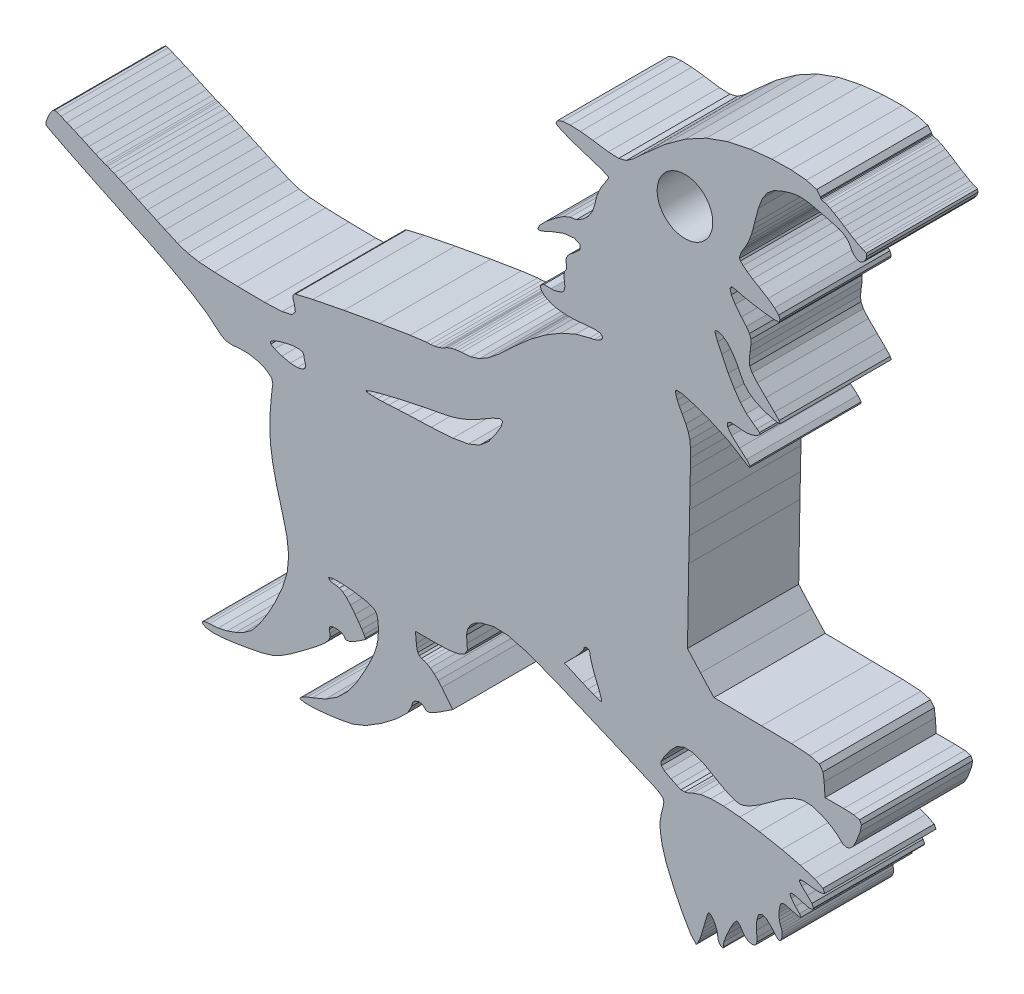
from build123d import *

# Parameters (mm, degrees)
BOSS_EXTRU_4_DEPTH      = 5
ESQUISSE8_R             = 1.25
ENL_V_MAT_EXTRU_1_DEPTH = 5


with BuildPart() as part:
    # Esquisse7 → Boss.-Extru.4 (new body)
    with BuildSketch(Plane.XY):
        Polygon((32.533763082, 34.408827277), (31.50376639, 34.193223455), (30.550335001, 33.849328679), (29.629146309, 33.352969468), (28.695870877, 32.67996209), (27.706172431, 31.806126231), (27.285148669, 31.41185523), (26.957491395, 31.184164666), (26.615053656, 31.094832785), (26.149702163, 31.115654912), (25.453296794, 31.218419543), (24.898611712, 31.285696025), (24.437964414, 31.303272702), (24.088139005, 31.271815745), (23.865929836, 31.192001575), (23.788127845, 31.064496363), (23.848689661, 31.005388167), (24.01738989, 30.91740571), (24.274748996, 30.808594293), (24.60129086, 30.68702313), (24.977534237, 30.560747773), (25.353777615, 30.444437657), (25.680321187, 30.335516919), (25.937678585, 30.241371522), (26.106378814, 30.169390845), (26.16694063, 30.126964265), (26.15272214, 30.09125406), (26.113655456, 30.022634986), (26.055107527, 29.928486173), (25.982457262, 29.816207248), (25.901073319, 29.693180757), (25.809614813, 29.546308746), (25.723531799, 29.367870457), (25.648191226, 29.173310819), (25.58897371, 28.978081594), (25.551247909, 28.797627709), (25.444115586, 28.463807495), (25.255044176, 28.165589874), (25.006191566, 27.925136149), (24.719727601, 27.764607623), (24.417813582, 27.706172431), (24.141646236, 27.595907394), (23.743238139, 27.32780243), (23.338783256, 26.995886783), (23.044482381, 26.694198238), (22.976532895, 26.516766039), (23.021644658, 26.507697567), (23.115791763, 26.528183193), (23.247550224, 26.574193433), (23.405502887, 26.641697097), (23.5782326, 26.726661285), (24.155528224, 26.942712638), (24.613268281, 26.987491315), (24.878911827, 26.887861107), (24.879919625, 26.670689219), (24.54375073, 26.362842859), (24.417811874, 26.267467607), (24.325460016, 26.16738816), (24.266688322, 26.064625238), (24.241501918, 25.961187604), (24.249897386, 25.859094269), (24.268480152, 25.775920204), (24.274303174, 25.697446917), (24.268030914, 25.628378604), (24.250346624, 25.573412628), (24.221911353, 25.537254893), (24.192020753, 25.499865594), (24.17086554, 25.426205823), (24.160454476, 25.323666666), (24.162804865, 25.199632377), (24.179932304, 25.061492336), (24.194261822, 24.899060951), (24.18373973, 24.776259933), (24.143661831, 24.685696489), (24.069332473, 24.619984656), (23.956044042, 24.571736762), (23.861562143, 24.541624106), (23.767754956, 24.518899119), (23.682005028, 24.504234807), (23.611705152, 24.498302465), (23.564239583, 24.501771681), (23.256840753, 24.505242605), (23.106612262, 24.40863579), (23.112881106, 24.252919071), (23.27497599, 24.079070532), (23.592225616, 23.928058009), (23.806261373, 23.871078146), (24.058584907, 23.83492041), (24.343817309, 23.820256098), (24.65659163, 23.827756505), (24.991527254, 23.858092927), (25.36407765, 23.889437147), (25.621101962, 23.897274056), (25.781406723, 23.878242051), (25.863796756, 23.828988068), (25.887080302, 23.746148796), (25.862341428, 23.672600053), (25.78991322, 23.60442851), (25.672482569, 23.543641221), (25.512739784, 23.492260614), (25.313366631, 23.452295452), (24.685471016, 23.285385345), (24.017950157, 22.99018941), (23.321544789, 22.572751016), (22.607005893, 22.039113534), (21.885077618, 21.395322044), (21.261882782, 20.810637042), (20.768323199, 20.41200518), (20.352674927, 20.167183762), (19.963220858, 20.043933506), (19.548243882, 20.010013423), (19.389168976, 20.000386391), (19.222709816, 19.973297128), (19.061622731, 19.931429107), (18.918670882, 19.877472637), (18.806614014, 19.814111193), (18.689741923, 19.74940545), (18.533246296, 19.692763796), (18.351224346, 19.648881888), (18.157786951, 19.622462212), (17.967033031, 19.618208964), (17.237493321, 19.524958628), (15.865171626, 19.295363498), (14.268510722, 19.004644576), (12.865963634, 18.728029699), (12.075973136, 18.540746703), (12.013843255, 18.506604563), (11.978581434, 18.452311591), (11.970185966, 18.3745096), (11.98865685, 18.269842111), (12.033994086, 18.134949228), (12.080786651, 17.848147052), (11.92137866, 17.664112923), (11.483900463, 17.56470648), (10.696485827, 17.531794195), (9.487265105, 17.54724254), (8.44293804, 17.580042088), (7.74519008, 17.628289981), (7.243568969, 17.717509126), (6.787620315, 17.873224136), (6.226892289, 18.120956211), (5.835871009, 18.299731002), (5.422685436, 18.489924655), (5.01890313, 18.676087116), (4.656092502, 18.84277175), (4.36582111, 18.974530211), (4.131074254, 19.079310437), (3.921850731, 19.171327501), (3.750240272, 19.244539742), (3.628333035, 19.292900372), (3.568219177, 19.310362604), (3.497582586, 19.335772774), (3.332241184, 19.406187094), (3.091673014, 19.512870179), (2.795356971, 19.647090058), (2.462770883, 19.800118177), (2.118654477, 19.953144588), (1.805434974, 20.087367883), (1.543933435, 20.194050968), (1.354971772, 20.26446358), (1.259371474, 20.28987375), (1.156942492, 20.217780336), (1.037722039, 20.042254412), (0.93193487, 19.824409521), (0.869805896, 19.625374577), (0.881560032, 19.506264833), (1.127277365, 19.371482979), (1.705468905, 19.079534202), (2.478443206, 18.698251836), (3.308508827, 18.295477754), (4.05797475, 17.939046999), (5.515487387, 17.248464652), (6.637167632, 16.682809946), (7.483464989, 16.209174014), (8.114830674, 15.794644569), (8.591712057, 15.406311034), (8.74966472, 15.272760743), (8.901573159, 15.187572789), (9.068258646, 15.145369975), (9.270541602, 15.140780225), (9.529244154, 15.168429755), (9.972765722, 15.174138332), (10.407558736, 15.08984544), (10.77451073, 14.939727978), (11.014519486, 14.747967968), (11.068475956, 14.538744018), (11.048660772, 14.422768696), (11.024145664, 14.222166542), (10.996943663, 13.956411113), (10.969069513, 13.6449828), (10.942538809, 13.307358577), (10.930784299, 12.690658058), (10.969406015, 12.081346918), (11.068475956, 11.426361186), (11.238071246, 10.672642014), (11.488266448, 9.767125433), (11.700512083, 8.920715339), (11.779098106, 8.207967419), (11.717976023, 7.547608757), (11.511103317, 6.858369429), (11.152434054, 6.058976092), (10.92888144, 5.640304854), (10.690553485, 5.241784021), (10.456254159, 4.890279518), (10.244791703, 4.612658124), (10.074971793, 4.435786192), (9.76589387, 4.216935638), (9.405769279, 4.035026425), (9.014076703, 3.896774928), (8.610294824, 3.808899229), (8.213900615, 3.778114422), (8.090538476, 3.771621386), (7.99269839, 3.753039046), (7.925756702, 3.723709568), (7.895083777, 3.684976823), (7.906054254, 3.638184259), (8.052365145, 3.547509572), (8.341069325, 3.510568018), (8.773509387, 3.527359595), (9.351029631, 3.597884303), (10.074971793, 3.722142357), (10.616669095, 3.833414765), (11.040154276, 3.960807241), (11.432070617, 4.147306204), (11.879063962, 4.435898075), (12.467777594, 4.8695697), (13.003653582, 5.278501597), (13.356166737, 5.571906983), (13.556882482, 5.785384609), (13.637370511, 5.954532368), (13.629197954, 6.114948158), (13.601771334, 6.250512337), (13.60792915, 6.343090522), (13.654386066, 6.400069959), (13.747859313, 6.428839597), (13.895065265, 6.436787535), (14.009807316, 6.428727714), (14.114476513, 6.405890845), (14.202351358, 6.370292523), (14.266719746, 6.323947915), (14.30086274, 6.268871338), (14.363440151, 6.217041065), (14.485795346, 6.230363213), (14.670613508, 6.310179091), (14.920586652, 6.457833), (15.238394837, 6.674668813), (15.227871037, 6.719557665), (15.167645723, 6.828928495), (15.065104858, 6.99001558), (14.92763782, 7.19006003), (14.76263228, 7.416298681), (14.558334583, 7.68250164), (14.377544196, 7.8801957), (14.213546454, 8.014752081), (14.059623274, 8.09154542), (13.909058281, 8.1159495), (13.804278055, 8.122442109), (13.712261845, 8.141024876), (13.639049604, 8.170354355), (13.590689829, 8.209087099), (13.573225888, 8.255879664), (13.744946948, 8.316329597), (14.16787357, 8.319687784), (14.70363853, 8.276029642), (15.213879729, 8.195429731), (15.560234214, 8.087963467), (15.661656253, 8.021020071), (15.733524194, 7.915121873), (15.779869228, 7.76153434), (15.804720838, 7.551527212), (15.812108509, 7.276368517), (15.795204836, 6.973000025), (15.737329911, 6.666272918), (15.62773617, 6.329321271), (15.455679462, 5.935277879), (15.210408805, 5.457276388), (14.815246159, 4.763558765), (14.403292576, 4.212905728), (13.95103733, 3.783823426), (13.434974818, 3.454819717), (12.83159602, 3.204400751), (12.623155249, 3.1265994), (12.457030882, 3.048798477), (12.341952329, 2.977713928), (12.286652414, 2.920062769), (12.299861398, 2.882561374), (12.522964773, 2.841254048), (12.942868855, 2.847634775), (13.487701433, 2.895658902), (14.085594565, 2.979281139), (14.664681166, 3.09245662), (15.244663681, 3.32888257), (15.946217359, 3.761434942), (16.622248131, 4.277273262), (17.125661926, 4.763558765), (17.309361261, 5.107450979), (17.345071467, 5.273015932), (17.460710287, 5.390893686), (17.61866295, 5.446977634), (17.781318101, 5.427163304), (17.911060966, 5.317346224), (17.968824862, 5.265292186), (18.060841926, 5.260254905), (18.191145059, 5.302233527), (18.363763742, 5.391229334), (18.582725752, 5.52724147), (19.156439424, 5.905052912), (18.66668385, 6.520745633), (18.497758148, 6.708587615), (18.319434304, 6.878295215), (18.145807822, 7.018449144), (17.990989581, 7.117631822), (17.869081917, 7.164424386), (17.74403983, 7.19397763), (17.651240441, 7.253084972), (17.585976139, 7.347788928), (17.543547851, 7.484137139), (17.519256507, 7.668172976), (17.477277458, 8.1159495), (18.400816539, 8.1159495), (19.013822368, 8.137665835), (19.439434173, 8.209087099), (19.698472373, 8.339613997), (19.811760804, 8.538650648), (19.800118177, 8.815600319), (19.773027205, 9.115945418), (19.825193553, 9.378007866), (19.95527292, 9.600440799), (20.161921007, 9.781902482), (20.443796931, 9.921048613), (21.002509788, 10.05694844), (21.625702916, 10.03433619), (22.471889244, 9.812238904), (23.699579997, 9.349686185), (25.467289811, 8.605705073), (25.896034329, 8.423571241), (26.368442115, 8.223304735), (26.847561151, 8.020348775), (27.29645821, 7.830155976), (27.678186399, 7.668172976), (28.159881298, 7.462978509), (28.455526472, 7.312861901), (28.604077577, 7.185582162), (28.644488561, 7.048898303), (28.615718496, 6.870571042), (28.528065709, 6.518282934), (28.482057176, 6.24525129), (28.475675596, 5.993040921), (28.506908787, 5.703217487), (28.573739447, 5.317346224), (28.753855121, 4.728519429), (29.094504446, 3.931477762), (29.497613322, 3.121002279), (29.865128145, 2.491876382), (30.098978232, 2.238882621), (30.133345846, 2.26921947), (30.182492216, 2.353961387), (30.241036729, 2.483704466), (30.303612432, 2.649046081), (30.364845544, 2.840582325), (30.423167999, 3.036372458), (30.47880527, 3.228132895), (30.529068759, 3.401758309), (30.571273282, 3.543143801), (30.602726822, 3.638184259), (30.635748428, 3.718336212), (30.672135053, 3.755501746), (30.718589408, 3.746993968), (30.781838115, 3.690126414), (30.868594133, 3.582212193), (30.931955577, 3.481350422), (30.985912047, 3.369742366), (31.02777836, 3.25679065), (31.054869331, 3.151898969), (31.064496363, 3.064470587), (31.072333272, 2.979840552), (31.09360293, 2.897897623), (31.12494715, 2.824686236), (31.163007744, 2.766251472), (31.204426526, 2.728638194), (31.249651026, 2.703338839), (31.284131376, 2.694159552), (31.307191157, 2.700428396), (31.31816078, 2.721473862), (31.316370657, 2.756624227), (31.345364488, 2.956444484), (31.467717975, 3.287239382), (31.635746908, 3.648259248), (31.801760246, 3.938754404), (31.918070362, 4.05797475), (31.964524716, 4.043646086), (32.017702278, 4.003793661), (32.074231195, 3.943119962), (32.130763527, 3.866326623), (32.183937673, 3.778114422), (32.245058048, 3.689902222), (32.32364578, 3.613108883), (32.413647248, 3.552434971), (32.5090225, 3.512582973), (32.603728164, 3.498254095), (32.715559559, 3.512806738), (32.786423118, 3.56765955), (32.82235538, 3.679603895), (32.829409965, 3.865430708), (32.81362341, 4.141932848), (32.82201717, 4.550864318), (32.90765607, 4.800611989), (33.060462132, 4.886473373), (33.270353961, 4.803746411), (33.527267245, 4.547730323), (33.66484702, 4.382389136), (33.764810314, 4.28622857), (33.836568934, 4.254548702), (33.889517606, 4.282646618), (33.93306472, 4.36582111), (33.958362154, 4.450115284), (33.967545071, 4.54649876), (33.961276227, 4.646913001), (33.940232042, 4.743296905), (33.905078688, 4.827590651), (33.866905356, 4.919944217), (33.838136999, 5.03916499), (33.821455383, 5.175177554), (33.819552524, 5.317906064), (33.835113606, 5.457276388), (33.868586158, 5.635379456), (33.914818456, 5.740271138), (33.993290034, 5.782697717), (34.123483846, 5.773406761), (34.324869179, 5.723143699), (34.616928984, 5.644334765), (34.777349898, 5.616572924), (34.815519813, 5.650604036), (34.740853953, 5.757174811), (34.562750457, 5.947031961), (34.378156061, 6.167337844), (34.311771224, 6.309058984), (34.364275782, 6.37421055), (34.53633249, 6.364807711), (34.828617769, 6.282864354), (35.131650613, 6.201144763), (35.315127891, 6.203383697), (35.37367582, 6.282864354), (35.301917199, 6.432869507), (35.09448508, 6.64668278), (34.849887427, 6.873033314), (34.739624098, 7.020128664), (34.767049863, 7.096026515), (34.935526327, 7.108788396), (35.24840826, 7.066473272), (35.428076404, 7.048001961), (35.590957028, 7.042965107), (35.726968737, 7.051361002), (35.826040386, 7.073190073), (35.878093997, 7.108452321), (35.798163674, 7.269091876), (35.420020854, 7.456598637), (34.787981311, 7.657538147), (33.946388149, 7.858478511), (32.939560557, 8.045984418), (32.058560793, 8.173599805), (31.335402663, 8.23740878), (30.753291815, 8.23740878), (30.295440729, 8.173600659), (29.945055052, 8.045984418), (29.742436448, 7.952511171), (29.580119508, 7.909412442), (29.421157339, 7.920047271), (29.228613297, 7.987773846), (28.965543906, 8.1159495), (28.676391341, 8.273678398), (28.529633774, 8.410586023), (28.523253901, 8.576375595), (28.655234419, 8.820750337), (28.923564857, 9.193411761), (29.213612483, 9.494093363), (29.541273173, 9.64096452), (29.924010867, 9.634695676), (30.379286091, 9.47595898), (30.924566199, 9.165425729), (31.183491662, 9.012398464), (31.444436137, 8.878176877), (31.689255847, 8.771493792), (31.899824097, 8.701082033), (32.058000526, 8.675670155), (32.222780592, 8.706789756), (32.442641079, 8.797017552), (32.7088466, 8.941649349), (33.012661769, 9.135984367), (33.345358032, 9.375320974), (33.973028174, 9.831045436), (34.477787978, 10.116167664), (34.907984408, 10.244790849), (35.311991761, 10.231022452), (35.738163833, 10.08896481), (35.931046085, 9.997841098), (36.115865955, 9.897316683), (36.281206289, 9.794775818), (36.415649933, 9.697607882), (36.507779734, 9.613202253), (36.681961359, 9.448420478), (36.850106445, 9.389762375), (37.009516145, 9.43588279), (37.157505275, 9.585439985), (37.291388651, 9.837090515), (37.47228665, 10.305912932), (37.529604724, 10.598758478), (37.440498316, 10.757942704), (37.18213312, 10.825781162), (36.731667996, 10.844587694), (35.892087014, 10.844587694), (35.850107964, 11.432294382), (35.800739537, 11.801262826), (35.629803363, 12.026494533), (35.202285283, 12.14560257), (34.383191634, 12.196201706), (33.037511672, 12.215903299), (30.896580166, 12.243889332), (30.294880462, 12.901561102), (29.707173774, 13.559232872), (29.763145839, 16.88957077), (29.78665315, 17.982817878), (29.80680569, 19.016283786), (29.823596627, 19.920122982), (29.837029376, 20.62447458), (29.847103938, 21.059489651), (29.844080544, 21.427561325), (29.812849061, 21.73048485), (29.745347105, 22.000492673), (29.633515711, 22.269830908), (29.469292495, 22.57073542), (29.342125493, 22.797421602), (29.247867359, 23.000602182), (29.189206694, 23.170197472), (29.168835513, 23.296134619), (29.189432168, 23.368337354), (29.490111207, 23.358373821), (30.083642624, 23.184525282), (30.809489354, 22.907910405), (31.507124577, 22.589654689), (32.016021476, 22.290875093), (32.341331777, 22.07112905), (32.509473447, 22.00385086), (32.51775447, 22.070233989), (32.363496496, 22.251471906), (32.044007509, 22.528756371), (31.696867283, 22.84264781), (31.513618895, 23.088700792), (31.496937279, 23.256169458), (31.649517867, 23.334306242), (31.974042427, 23.312365288), (32.146884876, 23.288745241), (32.322412508, 23.284603021), (32.489881174, 23.299267333), (32.638543308, 23.33206859), (32.757651344, 23.38233037), (32.903064612, 23.459683122), (32.967211796, 23.520916234), (32.946054875, 23.586853541), (32.835566072, 23.678310338), (32.631714197, 23.816113878), (32.358679564, 24.029365603), (32.089682956, 24.323222363), (31.818663919, 24.707748472), (31.539589332, 25.193027031), (31.246405576, 25.789129187), (31.063936095, 26.178357783), (30.965424713, 26.414450648), (30.944155055, 26.535685308), (30.993414162, 26.580351249), (31.106475412, 26.586731121), (31.287598884, 26.525159799), (31.497610283, 26.356128193), (31.715004227, 26.103131655), (31.918295835, 25.789689455), (32.085986558, 25.439303778), (32.248194178, 25.146343787), (32.470179581, 24.902420846), (32.757989555, 24.702823928), (33.117664053, 24.542855669), (33.555253278, 24.417813582), (33.779698391, 24.376169327), (33.8731742, 24.39027508), (33.822241124, 24.492368415), (33.613466413, 24.71469032), (33.233413901, 25.089478369), (32.844854893, 25.471543059), (32.613467932, 25.738085082), (32.504994725, 25.95491876), (32.485180395, 26.187875494), (32.519770066, 26.502773023), (32.560963375, 26.802333235), (32.557161073, 27.025329853), (32.493577572, 27.216080356), (32.35543753, 27.418924434), (32.127965607, 27.678186399), (31.850568406, 28.022861791), (31.678621018, 28.316493077), (31.620185827, 28.531536633), (31.683321797, 28.640459078), (31.876091313, 28.615718496), (32.211363438, 28.524707521), (32.697760824, 28.431682659), (33.211027125, 28.354777437), (33.626899162, 28.312127092), (33.821120589, 28.321865152), (33.871606135, 28.439405123), (33.80522813, 28.590530383), (33.622642497, 28.775237516), (33.324535905, 28.993529938), (32.911574525, 29.245404233), (32.638656045, 29.407946647), (32.40066203, 29.568473465), (32.212371236, 29.714897946), (32.088562421, 29.835126517), (32.044007509, 29.917069019), (32.056767254, 29.999459053), (32.092368139, 30.106032817), (32.146772139, 30.227378506), (32.215954897, 30.354097978), (32.295881804, 30.476789675), (32.385213685, 30.634966103), (32.479919349, 30.845534353), (32.571936414, 31.090354063), (32.653209329, 31.351298538), (32.715672295, 31.610224001), (32.889966656, 32.283675494), (33.079043191, 32.769741502), (33.311103156, 33.109379613), (33.614361474, 33.34356791), (34.017022819, 33.513274229), (34.330687076, 33.609209748), (34.591969761, 33.66283484), (34.839139861, 33.675481849), (35.110493692, 33.648503614), (35.444310489, 33.583239311), (36.093919877, 33.424055085), (36.520542896, 33.297113556), (36.783274077, 33.174196385), (36.941228448, 33.027102316), (37.053507373, 32.827616426), (37.126717905, 32.704029668), (37.209336828, 32.604623225), (37.297322702, 32.533428289), (37.386654583, 32.494472633), (37.473297864, 32.491784033), (37.617033746, 32.56857481), (37.719798376, 32.703134607), (37.767486002, 32.852469745), (37.745994287, 32.973589961), (37.641214061, 33.023518656), (37.556251581, 33.048928826), (37.411504485, 33.119344854), (37.221088776, 33.226024523), (36.999103373, 33.36024611), (36.759654029, 33.513274229), (36.525465732, 33.666298932), (36.303371008, 33.800523935), (36.10881137, 33.90720702), (35.95723858, 33.977619632), (35.864100981, 34.003029802), (35.807565232, 34.009411383), (35.757756106, 34.027210117), (35.71801471, 34.054410409), (35.691706062, 34.089003496), (35.682191768, 34.12896695), (35.514610365, 34.331363496), (35.053513829, 34.465246873), (34.361361709, 34.525923134), (33.500627221, 34.508684667), align=None)
        Polygon((21.1014687, 17.617207622), (20.758470694, 17.138758173), (20.369129362, 16.808747094), (19.860232462, 16.597620285), (19.158566048, 16.475825357), (18.190921293, 16.413808213), (17.688404267, 16.395561948), (17.179842162, 16.375300088), (16.702848042, 16.354366932), (16.295036679, 16.334105071), (15.994017722, 16.315857099), (15.761060988, 16.310930846), (15.557660059, 16.313393972), (15.396572974, 16.323917773), (15.290561185, 16.343171835), (15.252387854, 16.371829164), (15.475603112, 16.465861824), (16.064206569, 16.627061646), (16.896623647, 16.825203236), (17.851283182, 17.030061201), (18.806614014, 17.211410147), (19.116363233, 17.28092599), (19.447605876, 17.384700126), (19.784893598, 17.516682352), (20.112778053, 17.670829298), (20.415810898, 17.841095884), (20.951909797, 18.150956132), (21.275764769, 18.28820282), (21.40013556, 18.248124922), (21.337783622, 18.026026782), align=None, mode=Mode.SUBTRACT)
        Polygon((12.453784578, 16.38582218), (12.458486211, 16.334774659), (12.471247664, 16.269624801), (12.490054196, 16.19641256), (12.512891065, 16.121186432), (12.537742676, 16.049989787), (12.5346074, 15.889685026), (12.405201037, 15.781772087), (12.171013593, 15.731621335), (11.853540202, 15.744606553), (11.474273431, 15.826101525), (11.148403717, 15.941740346), (10.976346155, 16.042600409), (10.95742774, 16.137417101), (11.090977177, 16.234922394), (11.376322317, 16.343843131), (11.708683786, 16.43283851), (12.003433899, 16.481533934), (12.239747112, 16.489929402), (12.396804714, 16.458026623), align=None, mode=Mode.SUBTRACT)
        Polygon((25.327359647, 11.138441038), (25.341687457, 11.040154276), (25.38154159, 10.8894774), (25.442214435, 10.70118746), (25.519008628, 10.490060652), (25.607219975, 10.270874023), (25.693752228, 10.059635331), (25.765510848, 9.870561359), (25.817786516, 9.715743118), (25.845885286, 9.607269911), (25.845101253, 9.557230187), (25.78722462, 9.559693313), (25.657483463, 9.597082612), (25.471319294, 9.664025155), (25.244185581, 9.755147158), (24.991527254, 9.865076548), (24.179932304, 10.228894973), (24.613715812, 10.662678481), (24.750173343, 10.810893085), (24.869173767, 10.948360122), (24.963317456, 11.067691924), (25.025223571, 11.161501673), (25.047499319, 11.222399136), (25.05533452, 11.255534333), (25.076605887, 11.285984346), (25.107950107, 11.311058868), (25.146010701, 11.328074423), (25.187429483, 11.334343267), (25.23422034, 11.324715382), (25.272955647, 11.297626119), (25.302284271, 11.255758952), (25.320867038, 11.201801628), align=None, mode=Mode.SUBTRACT)
    extrude(amount=BOSS_EXTRU_4_DEPTH)

    # Esquisse8 → Enlèv. mat.-Extru.1 (cut)
    with BuildSketch(Plane(origin=(0, 0, 0), x_dir=(-1, 0, 0), z_dir=(0, 0, -1))):
        with Locations((-29.59355309, 30.711050741)):
            Circle(ESQUISSE8_R)
    extrude(amount=-ENL_V_MAT_EXTRU_1_DEPTH, mode=Mode.SUBTRACT)


solid = part.part
